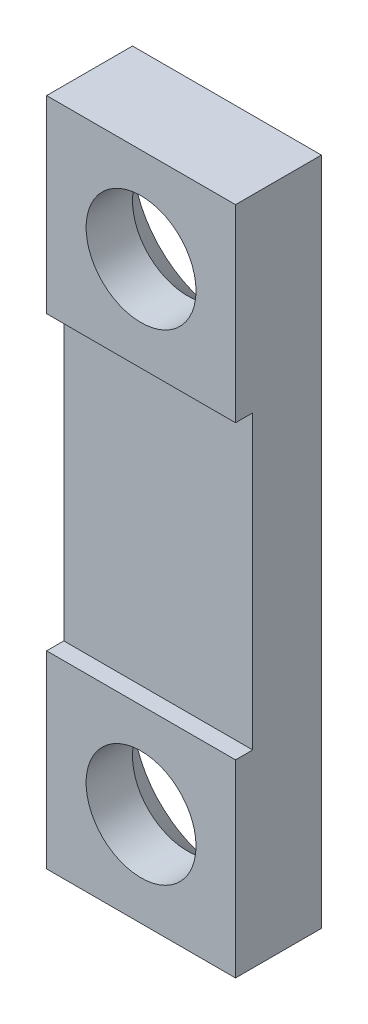
from build123d import *

# Parameters (mm, degrees)
SKETCH1_W             = 5.5
SKETCH1_H             = 5.5
SKETCH1_R             = 1.6
BOSS_EXTRUDE1_DEPTH   = 2.5
BOSS_EXTRUDE1_2_DEPTH = 2.5
SKETCH1_4_W           = 8.5
SKETCH1_4_H           = 2.75
BOSS_EXTRUDE2_DEPTH   = 2
CHAMFER1_SIZE         = 1.15


with BuildPart() as part:
    # Sketch1 → Boss-Extrude1 (new body)
    with BuildSketch(Plane(origin=(0, 0, 0), x_dir=(0, 1, 0), z_dir=(0, 0, 1))):
        with Locations((-7, 0)):
            Rectangle(SKETCH1_W, SKETCH1_H)
        with Locations(Location((-7, 0, 0), (0, 0, 270))):
            Circle(SKETCH1_R, mode=Mode.SUBTRACT)
    extrude(amount=BOSS_EXTRUDE1_DEPTH)



with BuildPart() as body_2:
    # Sketch1 → Boss-Extrude1 2 (new body)
    with BuildSketch(Plane(origin=(0, 0, 0), x_dir=(0, 1, 0), z_dir=(0, 0, 1))):
        with Locations((7, 0)):
            Rectangle(SKETCH1_W, SKETCH1_H)
        with Locations(Location((7, 0, 0), (0, 0, 270))):
            Circle(SKETCH1_R, mode=Mode.SUBTRACT)
    extrude(amount=BOSS_EXTRUDE1_2_DEPTH)


with BuildPart() as part_1:
    add(part.part)

    add(body_2.part)  # Boss-Extrude2 merges body 2
    # Sketch1<4> → Boss-Extrude2 (add)
    with BuildSketch(Plane(origin=(0, 0, 0), x_dir=(0, 1, 0), z_dir=(0, 0, 1))):
        with Locations((0, -1.375)):
            Rectangle(SKETCH1_4_W, SKETCH1_4_H)
        with Locations((0, 1.375)):
            Rectangle(SKETCH1_4_W, SKETCH1_4_H)
    extrude(amount=BOSS_EXTRUDE2_DEPTH)

    # Chamfer1
    chamfer1_edges = [part_1.edges().sort_by_distance(p)[0] for p in [
        (-1.6, 7, 0),
        (-1.6, -7, 0),
    ]]
    chamfer(chamfer1_edges, length=CHAMFER1_SIZE - 0.0001)  # a hair under: the kernel refuses the full size


solid = part_1.part
